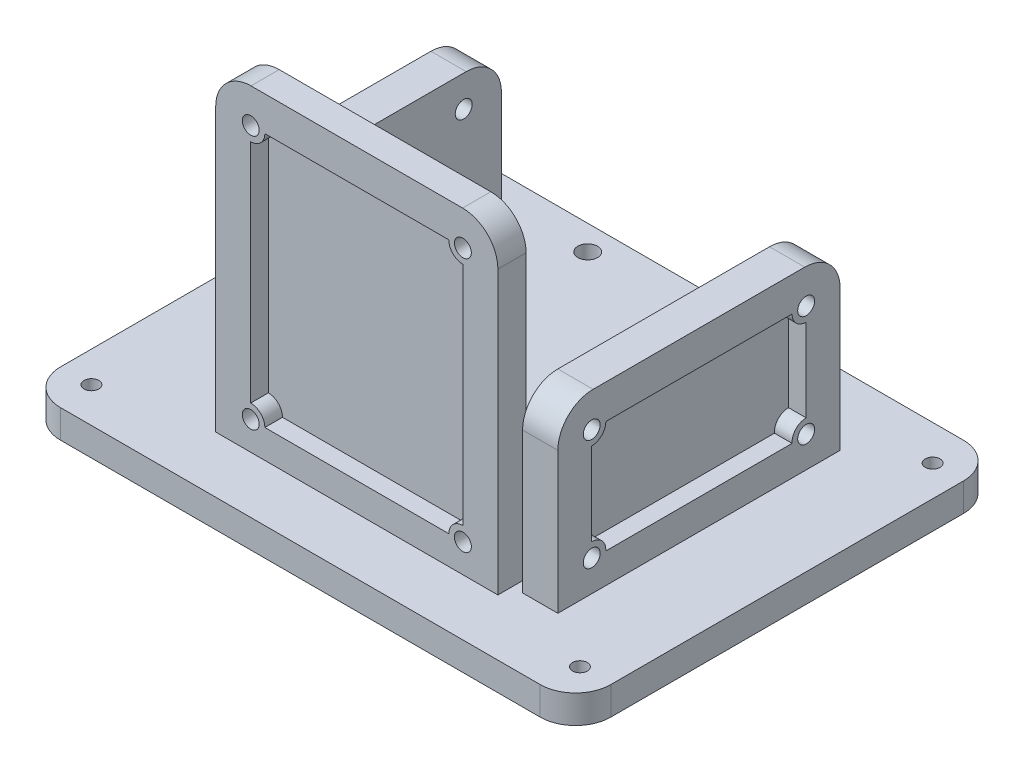
from build123d import *

# Parameters (mm, degrees)
SKETCH5_W           = 156
SKETCH5_H           = 120
BOSS_EXTRUDE3_DEPTH = 8
SKETCH6_R           = 2.1
CUT_EXTRUDE2_DEPTH  = 99.731960378
FILLET1_R           = 10
SKETCH12_R          = 2.8
CUT_EXTRUDE4_DEPTH  = 10
SKETCH13_W          = 10
SKETCH13_H          = 50
SKETCH13_H_2        = 80
BOSS_EXTRUDE4_DEPTH = 50
SKETCH14_W          = 80
SKETCH14_H          = 8
BOSS_EXTRUDE5_DEPTH = 90
FILLET2_R           = 10
SKETCH15_R          = 2.4
CUT_EXTRUDE5_DEPTH  = 10
CUT_EXTRUDE6_DEPTH  = 5
SKETCH17_R          = 2.4
CUT_EXTRUDE7_DEPTH  = 10
CUT_EXTRUDE8_DEPTH  = 5
SKETCH20_R          = 2.4
CUT_EXTRUDE9_DEPTH  = 15
CUT_EXTRUDE10_DEPTH = 5
FILLET3_R           = 8


with BuildPart() as part:
    # Sketch5 → Boss-Extrude3 (new body)
    with BuildSketch(Plane(origin=(0, 0, 0), x_dir=(1, 0, 0), z_dir=(0, 1, 0))):
        Rectangle(SKETCH5_W, SKETCH5_H)
    extrude(amount=BOSS_EXTRUDE3_DEPTH)

    # Sketch6 → Cut-Extrude2 (cut, through all)
    with BuildSketch(Plane(origin=(0, 8, 0), x_dir=(1, 0, 0), z_dir=(0, 1, 0))):
        with Locations((-69.25, 50)):
            Circle(SKETCH6_R)
        with Locations((69.25, 50)):
            Circle(SKETCH6_R)
        with Locations((-69.25, -50)):
            Circle(SKETCH6_R)
        with Locations((69.25, -50)):
            Circle(SKETCH6_R)
    extrude(amount=-CUT_EXTRUDE2_DEPTH, mode=Mode.SUBTRACT)

    # Fillet1
    fillet1_edges = [part.edges().sort_by_distance(p)[0] for p in [
        (-78, 4, 60),
        (78, 4, 60),
        (78, 4, -60),
        (-78, 4, -60),
    ]]
    fillet(fillet1_edges, radius=FILLET1_R)

    # Sketch12 → Cut-Extrude4 (cut)
    with BuildSketch(Plane(origin=(0, 8, 0), x_dir=(1, 0, 0), z_dir=(0, 1, 0))):
        with Locations((-31.51107674, 52.97250687)):
            Circle(SKETCH12_R)
        with Locations((31.51107674, 52.97250687)):
            Circle(SKETCH12_R)
        with Locations((-31.51107674, -20.978641174)):
            Circle(SKETCH12_R)
        with Locations((31.51107674, -20.978641174)):
            Circle(SKETCH12_R)
    extrude(amount=-CUT_EXTRUDE4_DEPTH, mode=Mode.SUBTRACT)

    # Sketch13 → Boss-Extrude4 (add)
    with BuildSketch(Plane(origin=(0, 8, 0), x_dir=(1, 0, 0), z_dir=(0, 1, 0))):
        with Locations((-48, 15)):
            Rectangle(SKETCH13_W, SKETCH13_H)
        with Locations((48, 0)):
            Rectangle(SKETCH13_W, SKETCH13_H_2)
    extrude(amount=BOSS_EXTRUDE4_DEPTH)

    # Sketch14 → Boss-Extrude5 (add)
    with BuildSketch(Plane(origin=(0, 8, 0), x_dir=(1, 0, 0), z_dir=(0, 1, 0))):
        with Locations((0, -40)):
            Rectangle(SKETCH14_W, SKETCH14_H)
    extrude(amount=BOSS_EXTRUDE5_DEPTH)

    # Fillet2
    fillet2_edges = [part.edges().sort_by_distance(p)[0] for p in [
        (48, 58, 40),
        (48, 58, -40),
        (-48, 58, 10),
        (-48, 58, -40),
        (-40, 98, 40),
        (40, 98, 40),
    ]]
    fillet(fillet2_edges, radius=FILLET2_R)

    # Sketch15 → Cut-Extrude5 (cut)
    with BuildSketch(Plane.XY.offset(44)):
        with Locations((-30.076432851, 88.246615836)):
            Circle(SKETCH15_R)
        with Locations((30.076432851, 88.246615836)):
            Circle(SKETCH15_R)
        with Locations((-30.076432851, 16.086454914)):
            Circle(SKETCH15_R)
        with Locations((30.076432851, 16.086454914)):
            Circle(SKETCH15_R)
    extrude(amount=-CUT_EXTRUDE5_DEPTH, mode=Mode.SUBTRACT)

    # Sketch16 → Cut-Extrude6 (cut)
    with BuildSketch(Plane.XY.offset(44)):
        with BuildLine():
            Line((-26.076432851, 16.086454914), (26.076432851, 16.086454914))
            ThreePointArc((26.076432851, 16.086454914), (27.248005726, 18.914882039), (30.076432851, 20.086454914))
            Line((30.076432851, 20.086454914), (30.076432851, 84.246615836))
            ThreePointArc((30.076432851, 84.246615836), (27.248005726, 85.418188712), (26.076432851, 88.246615836))
            Line((26.076432851, 88.246615836), (-26.076432851, 88.246615836))
            ThreePointArc((-26.076432851, 88.246615836), (-27.248005726, 85.418188712), (-30.076432851, 84.246615836))
            Line((-30.076432851, 84.246615836), (-30.076432851, 20.086454914))
            ThreePointArc((-30.076432851, 20.086454914), (-27.248005726, 18.914882039), (-26.076432851, 16.086454914))
        make_face()
    extrude(amount=-CUT_EXTRUDE6_DEPTH, mode=Mode.SUBTRACT)

    # Sketch17 → Cut-Extrude7 (cut)
    with BuildSketch(Plane(origin=(53, 0, 0), x_dir=(0, 0, -1), z_dir=(1, 0, 0))):
        with Locations((-30.4, 48.288730061)):
            Circle(SKETCH17_R)
        with Locations((30.4, 48.288730061)):
            Circle(SKETCH17_R)
        with Locations((-30.4, 16.788730061)):
            Circle(SKETCH17_R)
        with Locations((30.4, 16.788730061)):
            Circle(SKETCH17_R)
    extrude(amount=-CUT_EXTRUDE7_DEPTH, mode=Mode.SUBTRACT)

    # Sketch19 → Cut-Extrude8 (cut)
    with BuildSketch(Plane(origin=(53, 0, 0), x_dir=(0, 0, -1), z_dir=(1, 0, 0))):
        with BuildLine():
            Line((-26.409375006, 16.515029204), (26.409375006, 16.515029204))
            ThreePointArc((26.409375006, 16.515029204), (27.476406028, 19.518674802), (30.4, 20.788730061))
            Line((30.4, 20.788730061), (30.4, 44.288730061))
            ThreePointArc((30.4, 44.288730061), (27.571572875, 45.460302937), (26.4, 48.288730061))
            Line((26.4, 48.288730061), (-26.4, 48.288730061))
            ThreePointArc((-26.4, 48.288730061), (-27.597188862, 45.434916871), (-30.472124862, 44.289380364))
            Line((-30.472124862, 44.289380364), (-30.472124862, 20.788079759))
            ThreePointArc((-30.472124862, 20.788079759), (-27.501137968, 19.544922892), (-26.409375006, 16.515029204))
        make_face()
    extrude(amount=-CUT_EXTRUDE8_DEPTH, mode=Mode.SUBTRACT)

    # Sketch20 → Cut-Extrude9 (cut)
    with BuildSketch(Plane.ZY.offset(53)):
        with Locations((-29.305, 49.121963485)):
            Circle(SKETCH20_R)
        with Locations((-29.305, 16.671963485)):
            Circle(SKETCH20_R)
    extrude(amount=-CUT_EXTRUDE9_DEPTH, mode=Mode.SUBTRACT)

    # Sketch21 → Cut-Extrude10 (cut)
    with BuildSketch(Plane.ZY.offset(53)):
        with BuildLine():
            Line((-25.305, 49.121963485), (0.695, 49.121963485))
            Line((0.695, 49.121963485), (0.695, 16.671963485))
            Line((0.695, 16.671963485), (-25.305, 16.671963485))
            ThreePointArc((-25.305, 16.671963485), (-26.476572875, 19.50039061), (-29.305, 20.671963485))
            Line((-29.305, 20.671963485), (-29.305, 45.121963485))
            ThreePointArc((-29.305, 45.121963485), (-26.476572875, 46.29353636), (-25.305, 49.121963485))
        make_face()
    extrude(amount=-CUT_EXTRUDE10_DEPTH, mode=Mode.SUBTRACT)

    # Fillet3
    fillet3_edges = [part.edges().sort_by_distance(p)[0] for p in [
        (-50.5, 16.671963485, 0.695),
        (-50.5, 49.121963485, 0.695),
    ]]
    fillet(fillet3_edges, radius=FILLET3_R)


solid = part.part
